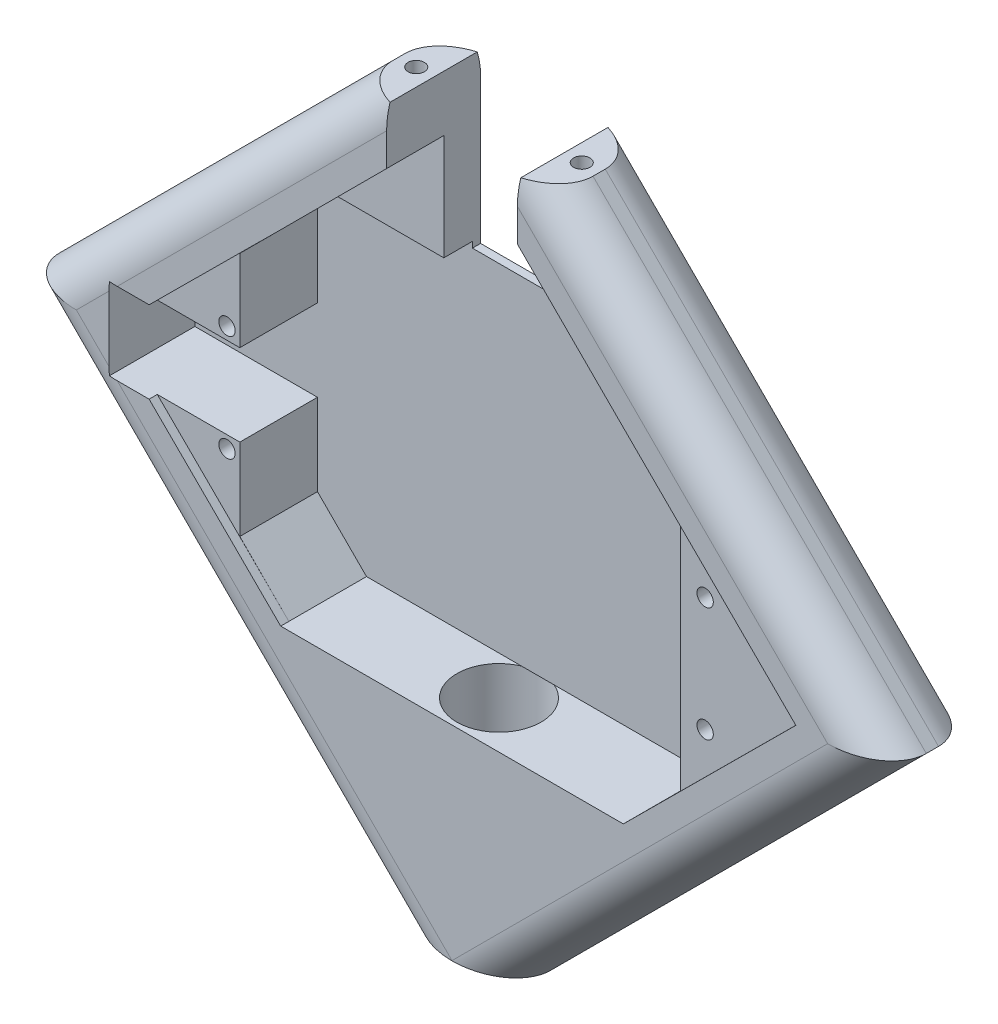
from build123d import *

# Parameters (mm, degrees)
BOSS_EXTRUDE1_DEPTH = 11.5
CUT_EXTRUDE1_DEPTH  = 10.5
CUT_EXTRUDE3_START  = 93.81
SKETCH10_R          = 1
CUT_EXTRUDE3_DEPTH  = 3
SKETCH11_R          = 5.15
CUT_EXTRUDE4_DEPTH  = 28.407206753
CUT_EXTRUDE6_START  = 11.5
CUT_EXTRUDE6_DEPTH  = 7
CUT_EXTRUDE10_START = 11.5
SKETCH17_R          = 1
CUT_EXTRUDE10_DEPTH = 7
CUT_EXTRUDE11_START = 11.5
CUT_EXTRUDE11_DEPTH = 1
FILLET1_R           = 5
FILLET2_R           = 5
SKETCH22_W          = 132.319501334
SKETCH22_H          = 14.071427362
CUT_EXTRUDE13_DEPTH = 143.060866263


with BuildPart() as part:
    # Sketch1 → Boss-Extrude1 (new body)
    with BuildSketch(Plane.XY):
        Polygon((0, 53.03), (49.407206753, 3.622793247), (56.652793247, 3.622793247), (106.06, 53.03), (65.28, 93.81), (61.03, 93.81), (61.03, 73.31), (45.03, 73.31), (45.03, 93.81), (40.78, 93.81), align=None)
    extrude(amount=BOSS_EXTRUDE1_DEPTH)

    # Sketch5 → Cut-Extrude1 (cut)
    with BuildSketch(Plane.XY.offset(11.5)):
        Polygon((26.07, 68.03), (32.07, 74.03), (73.99, 74.03), (79.99, 68.03), (79.99, 38.03), (73.99, 32.03), (32.07, 32.03), (26.07, 38.03), (26.07, 48.03), (11.07, 48.03), (11.07, 58.03), (26.07, 58.03), align=None)
    extrude(amount=-CUT_EXTRUDE1_DEPTH, mode=Mode.SUBTRACT)

    # Sketch10 → Cut-Extrude3 (cut)
    with BuildSketch(Plane(origin=(0, 0, 0), x_dir=(1, 0, 0), z_dir=(0, 1, 0)).offset(CUT_EXTRUDE3_START)):
        with Locations(Location((42.905, -5.75, 0), (0, 0, 270))):
            Circle(SKETCH10_R)
        with Locations(Location((63.155, -5.75, 0), (0, 0, 270))):
            Circle(SKETCH10_R)
    extrude(amount=-CUT_EXTRUDE3_DEPTH, mode=Mode.SUBTRACT)

    # Sketch11 → Cut-Extrude4 (cut)
    with BuildSketch(Plane.XZ.offset(-3.622793247)):
        with Locations(Location((53.03, 5.75, 0), (0, 0, 292.730860927))):
            Circle(SKETCH11_R)
    extrude(amount=-CUT_EXTRUDE4_DEPTH, mode=Mode.SUBTRACT)

    # Sketch13 → Cut-Extrude6 (cut)
    with BuildSketch(Plane.XY.offset(CUT_EXTRUDE6_START)):
        Polygon((73.99, 74.03), (61.03, 86.99), (61.03, 74.03), align=None)
        Polygon((32.07, 74.03), (45.03, 86.99), (45.03, 74.03), align=None)
    extrude(amount=-CUT_EXTRUDE6_DEPTH, mode=Mode.SUBTRACT)

    # Sketch17 → Cut-Extrude10 (cut)
    with BuildSketch(Plane.XY.offset(CUT_EXTRUDE10_START)):
        with Locations((24.5, 59.53)):
            Circle(SKETCH17_R)
        with Locations((24.5, 46.53)):
            Circle(SKETCH17_R)
        with Locations((83, 60.03)):
            Circle(SKETCH17_R)
        with Locations((83, 46.03)):
            Circle(SKETCH17_R)
    extrude(amount=-CUT_EXTRUDE10_DEPTH, mode=Mode.SUBTRACT)

    # Sketch19 → Cut-Extrude11 (cut)
    with BuildSketch(Plane.XY.offset(CUT_EXTRUDE11_START)):
        Polygon((13.96, 56.03), (13.96, 50.03), (32.07, 32.03), (73.99, 32.03), (95.1, 53.03), (73.99, 74.03), (32.07, 74.03), align=None)
    extrude(amount=-CUT_EXTRUDE11_DEPTH, mode=Mode.SUBTRACT)

    # Fillet1
    # the kernel refuses this fillet: 5 mm, written as the material it takes off along each edge
    with BuildSketch(Plane(origin=(47.813958483, -5.216041517, 11.5), x_dir=(0, 0, -1), z_dir=(0.7071067811865475, 0.7071067811865477, 0)), Plane(origin=(-8.838834765, 61.868834765, 11.5), x_dir=(0, 0, -1), z_dir=(0.7071067811865476, -0.7071067811865475, 0))) as fillet1_piece_1:
        with BuildLine():
            CenterArc((FILLET1_R, FILLET1_R), FILLET1_R, 180, 90)
            Line((0, FILLET1_R), (0, 0))
            Line((0, 0), (FILLET1_R, 0))
        make_face()
    extrude(amount=94.872341868, mode=Mode.SUBTRACT)
    with BuildSketch(Plane(origin=(49.618834765, 102.648834765, 11.5), x_dir=(0, 0, -1), z_dir=(-0.7071067811865472, -0.7071067811865479, 0)), Plane(origin=(114.898834765, 44.191165235, 11.5), x_dir=(0, 0, -1), z_dir=(-0.7071067811865476, 0.7071067811865476, 0))) as fillet1_piece_2:
        with BuildLine():
            CenterArc((FILLET1_R, FILLET1_R), FILLET1_R, 180, 90)
            Line((0, FILLET1_R), (0, 0))
            Line((0, 0), (FILLET1_R, 0))
        make_face()
    extrude(amount=82.671629074, mode=Mode.SUBTRACT)

    # Fillet2
    # the kernel refuses this fillet: 5 mm, written as the material it takes off along each edge
    with BuildSketch(Plane(origin=(49.618834765, 102.648834765, 0), x_dir=(0.7071067811865479, -0.7071067811865472, 0), z_dir=(-0.7071067811865472, -0.7071067811865479, 0)), Plane(origin=(114.898834765, 44.191165235, 0), x_dir=(-0.7071067811865476, -0.7071067811865476, 0), z_dir=(-0.7071067811865476, 0.7071067811865476, 0))) as fillet2_piece_1:
        with BuildLine():
            CenterArc((FILLET2_R, FILLET2_R), FILLET2_R, 180, 90)
            Line((0, FILLET2_R), (0, 0))
            Line((0, 0), (FILLET2_R, 0))
        make_face()
    extrude(amount=82.671629074, mode=Mode.SUBTRACT)
    with BuildSketch(Plane(origin=(-8.838834765, 61.868834765, 0), x_dir=(0, 0, 1), z_dir=(0.7071067811865476, -0.7071067811865475, 0))) as fillet2_piece_2:
        with BuildLine():
            CenterArc((FILLET2_R, -FILLET2_R), FILLET2_R, 90, 90)
            Line((0, -FILLET2_R), (0, 0))
            Line((0, 0), (FILLET2_R, 0))
        make_face()
    extrude(amount=94.872341868, mode=Mode.SUBTRACT)
    with BuildSketch(Plane(origin=(47.813958483, -5.216041517, 0), x_dir=(-0.7071067811865477, 0.7071067811865475, 0), z_dir=(0.7071067811865475, 0.7071067811865477, 0))) as fillet2_piece_3:
        with BuildLine():
            CenterArc((FILLET2_R, FILLET2_R), FILLET2_R, 180, 90)
            Line((0, FILLET2_R), (0, 0))
            Line((0, 0), (FILLET2_R, 0))
        make_face()
    extrude(amount=94.872341868, mode=Mode.SUBTRACT)

    # Sketch22 → Cut-Extrude13 (cut, through all)
    with BuildSketch(Plane.XY):
        Rectangle(SKETCH22_W, SKETCH22_H)
    extrude(amount=CUT_EXTRUDE13_DEPTH, mode=Mode.SUBTRACT)


solid = part.part
